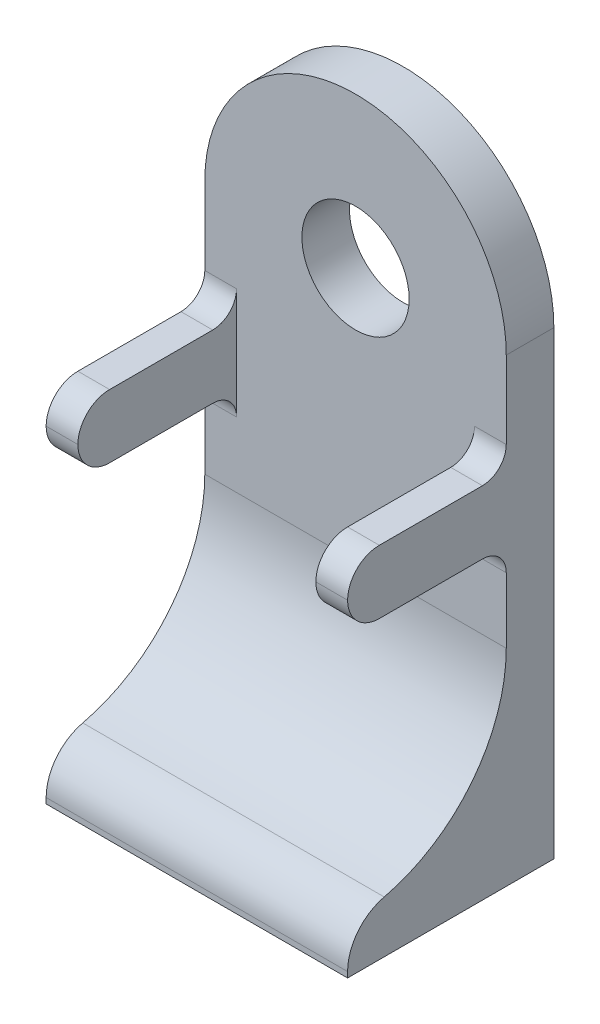
from build123d import *

# Parameters (mm, degrees)
CROQUIS2_R              = 3.38
SALIENTE_EXTRUIR1_DEPTH = 3
CROQUIS4_W              = 19
CROQUIS4_H              = 3
SALIENTE_EXTRUIR2_DEPTH = 10
REDONDEO1_R             = 10
CROQUIS7_W              = 2
CROQUIS7_H              = 4
SALIENTE_EXTRUIR4_DEPTH = 10
REDONDEO4_R             = 1.5
REDONDEO5_R             = 2
REDONDEO6_R             = 3


# Some blends are built 0.0001 mm under size
with BuildPart() as part:
    # Croquis2 → Saliente-Extruir1 (new body)
    with BuildSketch(Plane.XY):
        with BuildLine():
            Line((-9.5, 0), (-9.5, -29))
            Line((-9.5, -29), (9.5, -29))
            Line((9.5, -29), (9.5, 0))
            ThreePointArc((9.5, 0), (0, 9.5), (-9.5, 0))
        make_face()
        Circle(CROQUIS2_R, mode=Mode.SUBTRACT)
    extrude(amount=SALIENTE_EXTRUIR1_DEPTH)

    # Croquis4 → Saliente-Extruir2 (add)
    with BuildSketch(Plane.XY.offset(3)):
        with Locations((0, -27.5)):
            Rectangle(CROQUIS4_W, CROQUIS4_H)
    extrude(amount=SALIENTE_EXTRUIR2_DEPTH)

    # Redondeo1
    redondeo1_edges = [part.edges().sort_by_distance(p)[0] for p in [
        (0, -26, 3),
    ]]
    fillet(redondeo1_edges, radius=REDONDEO1_R - 0.0001)  # a hair under: the kernel refuses the full size

    # Croquis7 → Saliente-Extruir4 (add)
    with BuildSketch(Plane.XY.offset(3)):
        with Locations((-8.5, -8.38)):
            Rectangle(CROQUIS7_W, CROQUIS7_H)
        with Locations((8.5, -8.38)):
            Rectangle(CROQUIS7_W, CROQUIS7_H)
    extrude(amount=SALIENTE_EXTRUIR4_DEPTH)

    # Redondeo4
    redondeo4_edges = [part.edges().sort_by_distance(p)[0] for p in [
        (-8.5, -6.38, 3),
        (-8.5, -10.38, 3),
        (8.5, -6.38, 3),
        (8.5, -10.38, 3),
    ]]
    fillet(redondeo4_edges, radius=REDONDEO4_R)

    # Redondeo5
    redondeo5_edges = [part.edges().sort_by_distance(p)[0] for p in [
        (8.5, -10.38, 13),
        (8.5, -6.38, 13),
        (-8.5, -10.38, 13),
        (-8.5, -6.38, 13),
    ]]
    fillet(redondeo5_edges, radius=REDONDEO5_R - 0.0001)  # a hair under: the kernel refuses the full size

    # Redondeo6
    # the kernel refuses this fillet: 3 mm, written as the material it takes off along each edge
    with BuildSketch(Plane(origin=(16.122828959, -26, 13), x_dir=(0, -1, 0), z_dir=(-1, 0, 0))) as redondeo6_piece_1:
        with BuildLine():
            CenterArc((2.649131583, -3), REDONDEO6_R, 90, 76.657984638)
            Line((-0.269898159, -2.307710059), (-0.561801133, -2.238481065))
            ThreePointArc((-0.561801133, -2.238481065), (-0.3, -0.0001), (-0.3, 0))
            Line((-0.3, 0), (0, 0.3))
            Line((0, 0.3), (2.649131583, 0.3))
            Line((2.649131583, 0.3), (2.649131583, 0))
        make_face()
    extrude(amount=32.245657917, mode=Mode.SUBTRACT)


solid = part.part
